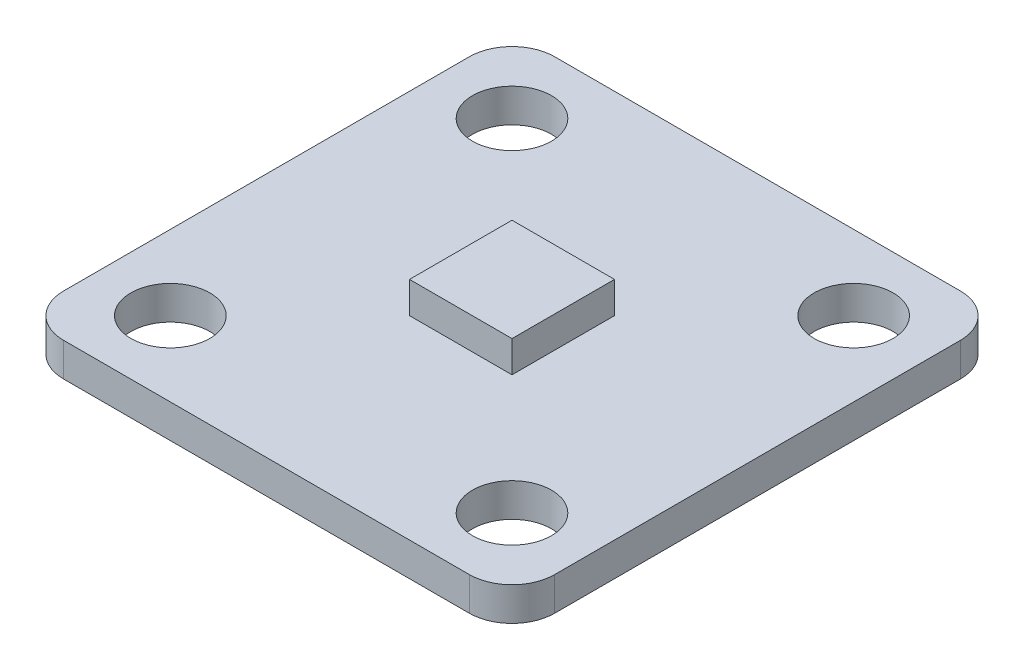
from build123d import *

# Parameters (mm, degrees)
SKETCH1_R           = 1.85
BOSS_EXTRUDE1_DEPTH = 1.57
SKETCH2_W           = 4.8
SKETCH2_H           = 4.8
BOSS_EXTRUDE2_DEPTH = 1.47


with BuildPart() as part:
    # Sketch1 → Boss-Extrude1 (new body)
    with BuildSketch(Plane(origin=(0, 0, 0), x_dir=(1, 0, 0), z_dir=(0, 1, 0))):
        with BuildLine():
            ThreePointArc((-11.5, -9.5), (-10.914213562, -10.914213562), (-9.5, -11.5))
            Line((-9.5, -11.5), (9.5, -11.5))
            ThreePointArc((9.5, -11.5), (10.914213562, -10.914213562), (11.5, -9.5))
            Line((11.5, -9.5), (11.5, 9.5))
            ThreePointArc((11.5, 9.5), (10.914213562, 10.914213562), (9.5, 11.5))
            Line((9.5, 11.5), (-9.5, 11.5))
            ThreePointArc((-9.5, 11.5), (-10.914213562, 10.914213562), (-11.5, 9.5))
            Line((-11.5, 9.5), (-11.5, -9.5))
        make_face()
        with Locations((-8, -8)):
            Circle(SKETCH1_R, mode=Mode.SUBTRACT)
        with Locations((8, -8)):
            Circle(SKETCH1_R, mode=Mode.SUBTRACT)
        with Locations((-8, 8)):
            Circle(SKETCH1_R, mode=Mode.SUBTRACT)
        with Locations((8, 8)):
            Circle(SKETCH1_R, mode=Mode.SUBTRACT)
    extrude(amount=BOSS_EXTRUDE1_DEPTH)

    # Sketch2 → Boss-Extrude2 (add)
    with BuildSketch(Plane(origin=(0, 1.57, 0), x_dir=(1, 0, 0), z_dir=(0, 1, 0))):
        Rectangle(SKETCH2_W, SKETCH2_H)
    extrude(amount=BOSS_EXTRUDE2_DEPTH)


solid = part.part
